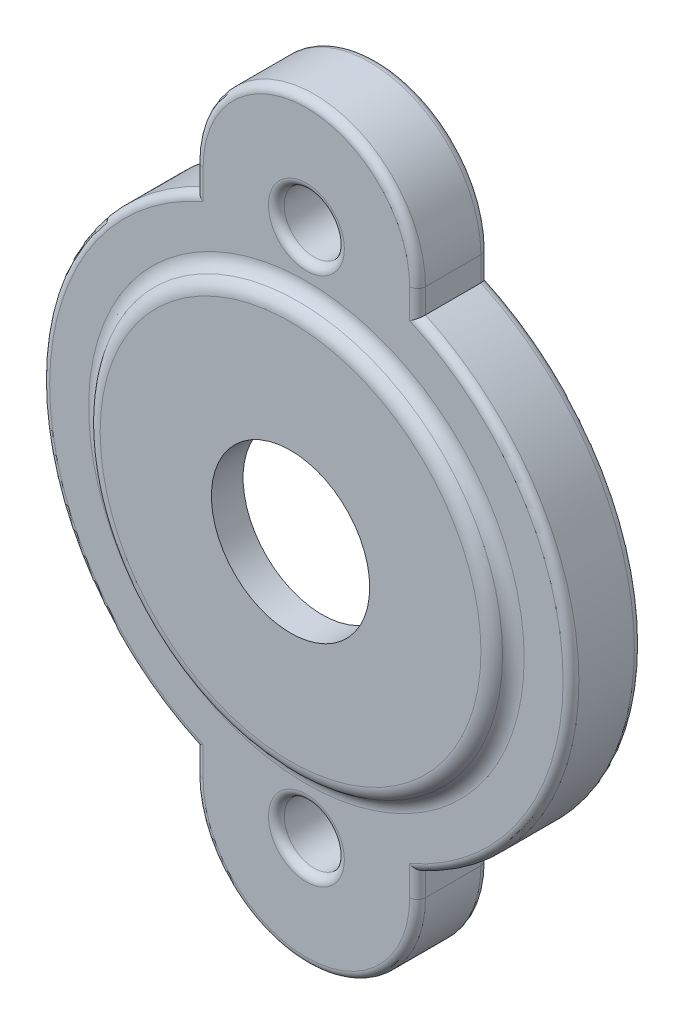
from build123d import *

# Parameters (mm, degrees)
SKETCH1_R                = 10.9
SKETCH1_R_2              = 1.9
BOSS_EXTRUDE1_DEPTH      = 4.5
BOSS_EXTRUDE2_DEPTH      = 1
BOSS_EXTRUDE2_DEPTH_BACK = 1
SKETCH2_R                = 12.759575688
SKETCH2_R_2              = 5
FILLET1_R                = 1
FILLET3_R                = 0.5


with BuildPart() as part:
    # Sketch1 → Boss-Extrude1 (new body)
    with BuildSketch(Plane.XY):
        with BuildLine():
            Line((-3.924451112, 17.782619509), (-3.924451112, 19.330033071))
            ThreePointArc((-3.924451112, 19.330033071), (-13.617380462, 34.5), (-3.924451112, 49.669966929))
            Line((-3.924451112, 49.669966929), (-3.924451112, 51.217380491))
            ThreePointArc((-3.924451112, 51.217380491), (3.100000029, 58.241831631), (10.124451169, 51.217380491))
            Line((10.124451169, 51.217380491), (10.124451169, 49.669966929))
            ThreePointArc((10.124451169, 49.669966929), (19.817380519, 34.5), (10.124451169, 19.330033071))
            Line((10.124451169, 19.330033071), (10.124451169, 17.782619509))
            ThreePointArc((10.124451169, 17.782619509), (3.100000029, 10.758168369), (-3.924451112, 17.782619509))
        make_face()
        with Locations((3.100000029, 34.5)):
            Circle(SKETCH1_R, mode=Mode.SUBTRACT)
        with Locations((3.100000029, 51.217380491)):
            Circle(SKETCH1_R_2, mode=Mode.SUBTRACT)
        with Locations((3.100000029, 17.782619509)):
            Circle(SKETCH1_R_2, mode=Mode.SUBTRACT)
    extrude(amount=BOSS_EXTRUDE1_DEPTH)

    # Sketch2 → Boss-Extrude2 (add, two sides: drawn at the far end of the back side and taken through both)
    with BuildSketch(Plane.XY.offset(4.5).offset(-BOSS_EXTRUDE2_DEPTH_BACK)):
        with Locations((3.100000029, 34.5)):
            Circle(SKETCH2_R)
        with Locations((3.100000029, 34.5)):
            Circle(SKETCH2_R_2, mode=Mode.SUBTRACT)
    extrude(amount=BOSS_EXTRUDE2_DEPTH + BOSS_EXTRUDE2_DEPTH_BACK)

    # Fillet1
    fillet1_edges = [part.edges().sort_by_distance(p)[0] for p in [
        (-9.659575659, 34.5, 4.5),
    ]]
    fillet(fillet1_edges, radius=FILLET1_R - 0.0001)  # a hair under: the kernel refuses the full size

    # Fillet2: read off the stored shape, not the designer's step
    # Fillet2 outline → Fillet2 (revolve, cut)
    with BuildSketch(Plane(origin=(3.100000029, 34.5, 0), x_dir=(1, 0, 0), z_dir=(0, -1, 0))):
        with BuildLine():
            Line((12.893550284, 5.5), (12.02752488, 5.5))
            ThreePointArc((12.02752488, 5.5), (12.52752488, 5.366025404), (12.893550284, 5))
            Line((12.893550284, 5), (12.893550284, 5.5))
        make_face()
    revolve(axis=Axis((3.100000029, 34.5, 0), (0, 0, 1)), mode=Mode.SUBTRACT)

    # Fillet3
    fillet3_edges = [part.edges().sort_by_distance(p)[0] for p in [
        (-3.924451112, 50.44367371, 0),
        (1.200000029, 51.217380491, 4.5),
        (3.100000029, 58.241831631, 0),
        (10.124451169, 50.44367371, 0),
        (19.817380519, 34.5, 0),
        (10.124451169, 18.55632629, 0),
        (3.100000029, 10.758168369, 0),
        (-3.924451112, 18.55632629, 0),
        (-13.617380462, 34.5, 0),
        (1.200000029, 17.782619509, 0),
        (1.200000029, 51.217380491, 0),
        (-7.799999971, 34.5, 0),
        (1.200000029, 17.782619509, 4.5),
        (-13.617380462, 34.5, 4.5),
        (-3.924451112, 18.55632629, 4.5),
        (3.100000029, 10.758168369, 4.5),
        (10.124451169, 18.55632629, 4.5),
        (19.817380519, 34.5, 4.5),
        (10.124451169, 50.44367371, 4.5),
        (3.100000029, 58.241831631, 4.5),
        (-3.924451112, 50.44367371, 4.5),
    ]]
    fillet(fillet3_edges, radius=FILLET3_R)


solid = part.part
